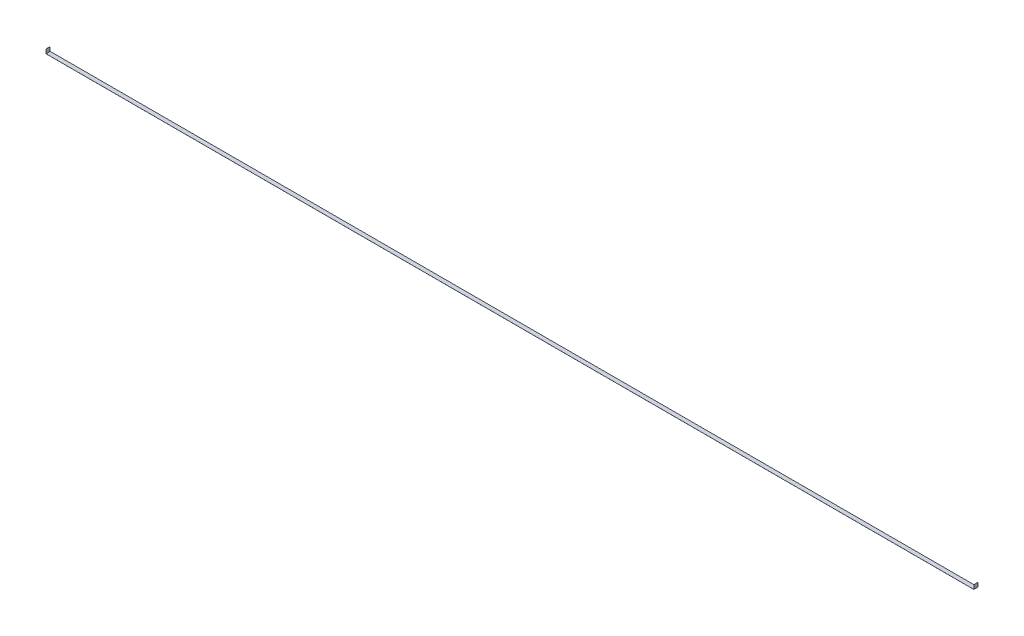
from build123d import *

# Parameters (mm, degrees)
EXTRUDE_THIN1_DEPTH = 25.4


with BuildPart() as part:
    # Sketch1 → Extrude-Thin1 (new body)
    with BuildSketch(Plane.XY):
        Polygon((-2832.1, 25.4), (-2832.1, 0), (2832.1, 0), (2832.1, 25.4), (2832.354, 25.4), (2832.354, -0.254), (-2832.354, -0.254), (-2832.354, 25.4), align=None)
    extrude(amount=EXTRUDE_THIN1_DEPTH)


solid = part.part
